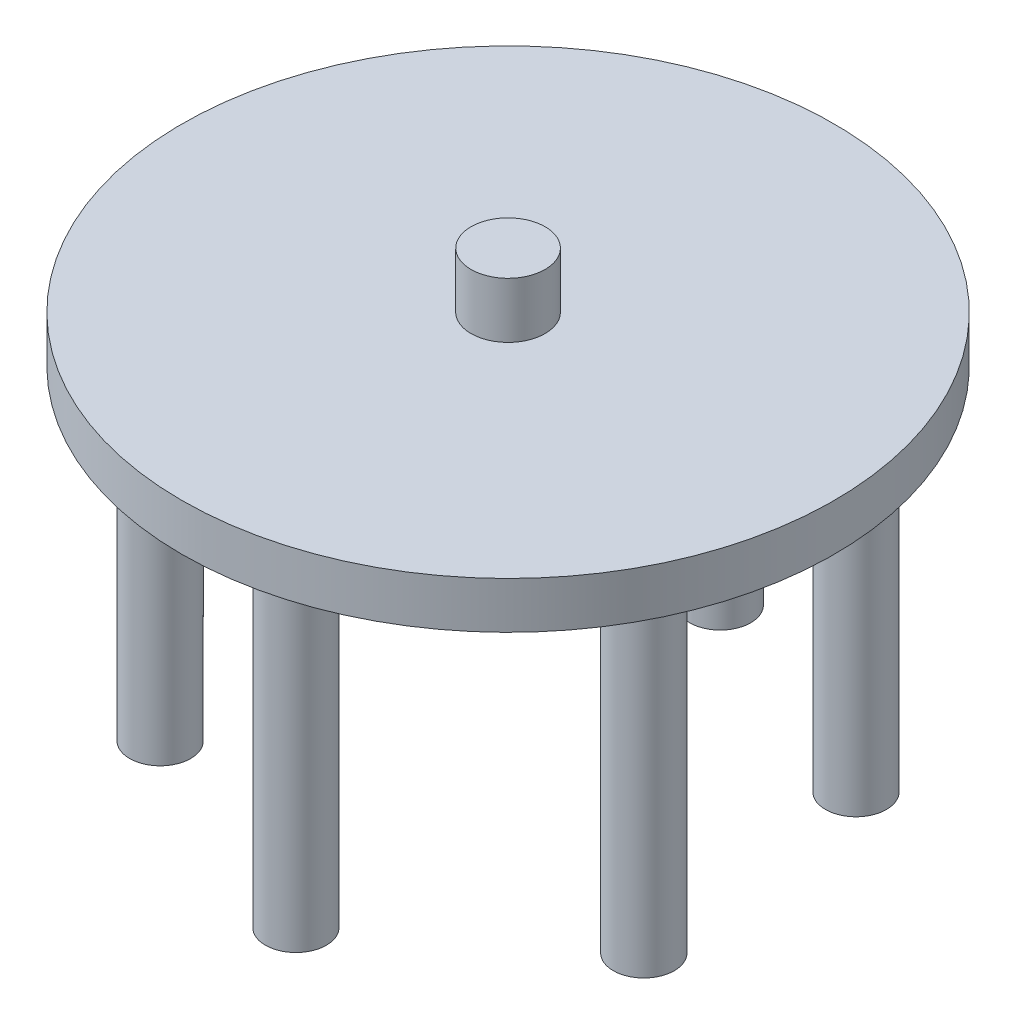
from build123d import *

# Parameters (mm, degrees)
SKETCH1_R           = 27.955
BOSS_EXTRUDE1_DEPTH = 4
SKETCH2_R           = 3.175
BOSS_EXTRUDE2_DEPTH = 4.76
SKETCH3_R           = 2.615316251
BOSS_EXTRUDE3_DEPTH = 29.718


with BuildPart() as part:
    # Sketch1 → Boss-Extrude1 (new body)
    with BuildSketch(Plane(origin=(0, 0, 0), x_dir=(1, 0, 0), z_dir=(0, 1, 0))):
        Circle(SKETCH1_R)
    extrude(amount=BOSS_EXTRUDE1_DEPTH)

    # Sketch2 → Boss-Extrude2 (add)
    with BuildSketch(Plane(origin=(0, 4, 0), x_dir=(1, 0, 0), z_dir=(0, 1, 0))):
        Circle(SKETCH2_R)
    extrude(amount=BOSS_EXTRUDE2_DEPTH)

    # Sketch3 → Boss-Extrude3 (add)
    with BuildSketch(Plane.XZ):
        with Locations((19.676080545, 8.041325394)):
            Circle(SKETCH3_R)
        with Locations((16.802032343, -13.019322902)):
            Circle(SKETCH3_R)
        with Locations((2.874048201, 21.060648295)):
            Circle(SKETCH3_R)
        with Locations((-2.874048201, -21.060648295)):
            Circle(SKETCH3_R)
        with Locations((-16.802032343, 13.019322902)):
            Circle(SKETCH3_R)
        with Locations((-19.676080545, -8.041325394)):
            Circle(SKETCH3_R)
    extrude(amount=BOSS_EXTRUDE3_DEPTH)


solid = part.part
